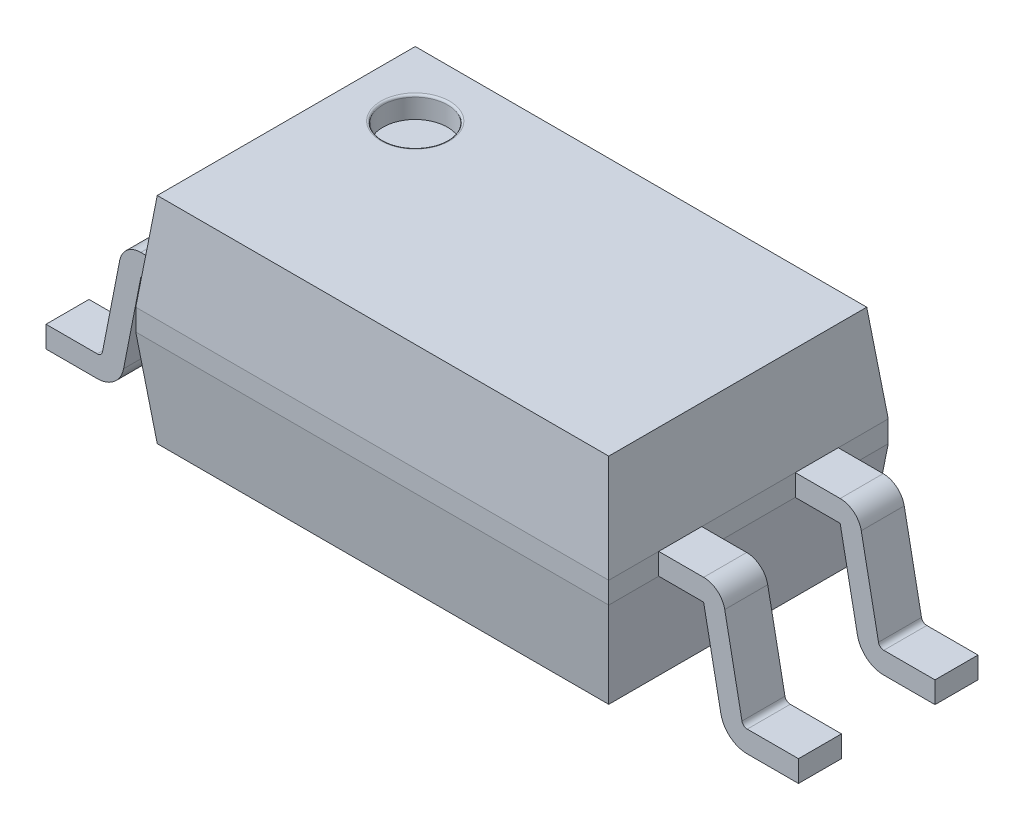
from build123d import *
from OCP.BRepFilletAPI import BRepFilletAPI_MakeChamfer

# Parameters (mm, degrees)
EXTRUDE_1_DEPTH          = 1
EXTRUDE_1_DEPTH_BACK     = 1
SKETCH_1_W               = 4.4
SKETCH_1_H               = 2.6
CHAMFER_1_SIZE           = 0.9
CHAMFER_1_SIZE2          = 0.1
CHAMFER_2_SIZE           = 0.1
CHAMFER_2_SIZE2          = 0.9
SKETCH_3_W               = 0.4
SKETCH_3_H               = 0.2
PATTERN_LINEAR_1_COUNT   = 2
PATTERN_LINEAR_1_PITCH   = 1.27
MIRROR_2_COPY_1_SKETCH_W = 0.4
MIRROR_2_COPY_1_SKETCH_H = 0.2
MIRROR_2_COPY_2_SKETCH_W = 0.4
MIRROR_2_COPY_2_SKETCH_H = 0.2
SKETCH_4_R               = 0.3
CUT_EXTRUDE_2_DEPTH      = 0.2
FILLET_1_R               = 0.02


with BuildPart() as part:
    # Эскиз1 → Вытянуть1 (new, two sides: drawn at the far end of the back side and taken through both)
    with BuildSketch(Plane(origin=(0, 0, 0), x_dir=(1, 0, 0), z_dir=(0, 1, 0)).offset(-EXTRUDE_1_DEPTH_BACK)):
        Rectangle(SKETCH_1_W, SKETCH_1_H)
    extrude(amount=EXTRUDE_1_DEPTH + EXTRUDE_1_DEPTH_BACK)

    # Фаска1: one chamfer whose edges measure the first distance from different faces: ONE call of the kernel's chamfer builder (chamfer() names one face for all edges)
    chamfer_1_edges_1 = [part.edges().sort_by_distance(p)[0] for p in [
        (0, 1, -1.3),
    ]]
    chamfer_1_side_1 = [part.faces().sort_by_distance(p)[0] for p in [
        (0, 0, -1.3),
    ]]
    chamfer_1_edges_2 = [part.edges().sort_by_distance(p)[0] for p in [
        (2.2, 1, 0),
    ]]
    chamfer_1_side_2 = [part.faces().sort_by_distance(p)[0] for p in [
        (2.2, 0, 0),
    ]]
    chamfer_1_edges_3 = [part.edges().sort_by_distance(p)[0] for p in [
        (0, 1, 1.3),
    ]]
    chamfer_1_side_3 = [part.faces().sort_by_distance(p)[0] for p in [
        (0, 0, 1.3),
    ]]
    chamfer_1_edges_4 = [part.edges().sort_by_distance(p)[0] for p in [
        (-2.2, 1, 0),
    ]]
    chamfer_1_side_4 = [part.faces().sort_by_distance(p)[0] for p in [
        (-2.2, 0, 0),
    ]]
    chamfer_1 = BRepFilletAPI_MakeChamfer(part.part.solid().wrapped)
    for e in chamfer_1_edges_1:
        chamfer_1.Add(CHAMFER_1_SIZE, CHAMFER_1_SIZE2, e.wrapped, chamfer_1_side_1[0].wrapped)  # the first distance lies on this face
    for e in chamfer_1_edges_2:
        chamfer_1.Add(CHAMFER_1_SIZE, CHAMFER_1_SIZE2, e.wrapped, chamfer_1_side_2[0].wrapped)  # the first distance lies on this face
    for e in chamfer_1_edges_3:
        chamfer_1.Add(CHAMFER_1_SIZE, CHAMFER_1_SIZE2, e.wrapped, chamfer_1_side_3[0].wrapped)  # the first distance lies on this face
    for e in chamfer_1_edges_4:
        chamfer_1.Add(CHAMFER_1_SIZE, CHAMFER_1_SIZE2, e.wrapped, chamfer_1_side_4[0].wrapped)  # the first distance lies on this face
    add(Compound.cast(chamfer_1.Shape()), mode=Mode.REPLACE)

    # Фаска2
    chamfer_2_edges = [part.edges().sort_by_distance(p)[0] for p in [
        (0, -1, 1.3),
        (2.2, -1, 0),
        (0, -1, -1.3),
        (-2.2, -1, 0),
    ]]
    chamfer_2_side = [part.faces().sort_by_distance(p)[0] for p in [
        (0, -1, 0),
    ]]
    chamfer(chamfer_2_edges, length=CHAMFER_2_SIZE, length2=CHAMFER_2_SIZE2, reference=chamfer_2_side[0])

    # По траектории2: sweep along a path in Эскиз2
    with BuildLine(Plane.XY.offset(0.635)) as sweep_2_path:
        Line((2.2, 0), (2.617703636, 0))
        ThreePointArc((2.617703636, 0), (2.681248326, -0.022785543), (2.715835011, -0.080758554))
        Line((2.715835011, -0.080758554), (2.876247484, -0.898862169))
        ThreePointArc((2.876247484, -0.898862169), (2.928127511, -0.985821685), (3.023444547, -1.02))
        Line((3.023444547, -1.02), (3.5, -1.02))
    # Эскиз3 → По траектории2 (sweep)
    with BuildSketch(Plane(origin=(3.5, -1.02, 0.635), x_dir=(0, 0, 1), z_dir=(-1, 0, 0))):
        Rectangle(SKETCH_3_W, SKETCH_3_H)
    sweep_2 = sweep(path=sweep_2_path.line)

    # Линейный массив1: По траектории2 ×2
    with Locations(*[(0, 0, -i * PATTERN_LINEAR_1_PITCH) for i in range(1, PATTERN_LINEAR_1_COUNT)]):
        add(sweep_2)

    # Зеркальное отражение2 copy 1: sweep along a path in Зеркальное отражение2 copy 1 path
    with BuildLine(Plane(origin=(0, 0, -0.635), x_dir=(-1, 0, 0), z_dir=(0, 0, 1))) as mirror_2_copy_1_path:
        Line((2.2, 0), (2.617703636, 0))
        ThreePointArc((2.617703636, 0), (2.681248326, 0.022785543), (2.715835011, 0.080758554))
        Line((2.715835011, 0.080758554), (2.876247484, 0.898862169))
        ThreePointArc((2.876247484, 0.898862169), (2.928127511, 0.985821685), (3.023444547, 1.02))
        Line((3.023444547, 1.02), (3.5, 1.02))
    # Зеркальное отражение2 copy 1 sketch → Зеркальное отражение2 copy 1 (sweep)
    with BuildSketch(Plane(origin=(-3.5, -1.02, -0.635), x_dir=(0, 0, 1), z_dir=(1, 0, 0))):
        Rectangle(MIRROR_2_COPY_1_SKETCH_W, MIRROR_2_COPY_1_SKETCH_H)
    sweep(path=mirror_2_copy_1_path.line)

    # Зеркальное отражение2 copy 2: sweep along a path in Зеркальное отражение2 copy 2 path
    with BuildLine(Plane(origin=(0, 0, 0.635), x_dir=(-1, 0, 0), z_dir=(0, 0, 1))) as mirror_2_copy_2_path:
        Line((2.2, 0), (2.617703636, 0))
        ThreePointArc((2.617703636, 0), (2.681248326, 0.022785543), (2.715835011, 0.080758554))
        Line((2.715835011, 0.080758554), (2.876247484, 0.898862169))
        ThreePointArc((2.876247484, 0.898862169), (2.928127511, 0.985821685), (3.023444547, 1.02))
        Line((3.023444547, 1.02), (3.5, 1.02))
    # Зеркальное отражение2 copy 2 sketch → Зеркальное отражение2 copy 2 (sweep)
    with BuildSketch(Plane(origin=(-3.5, -1.02, 0.635), x_dir=(0, 0, 1), z_dir=(1, 0, 0))):
        Rectangle(MIRROR_2_COPY_2_SKETCH_W, MIRROR_2_COPY_2_SKETCH_H)
    sweep(path=mirror_2_copy_2_path.line)

    # Эскиз4 → Вытянуть2 (cut)
    with BuildSketch(Plane(origin=(0, 1, 0), x_dir=(1, 0, 0), z_dir=(0, 1, 0))):
        with Locations((-1.5, 0.6)):
            Circle(SKETCH_4_R)
    extrude(amount=-CUT_EXTRUDE_2_DEPTH, mode=Mode.SUBTRACT)

    # Скругление1
    fillet_1_edges = [part.edges().sort_by_distance(p)[0] for p in [
        (-1.8, 1, -0.6),
    ]]
    fillet(fillet_1_edges, radius=FILLET_1_R)


solid = part.part
